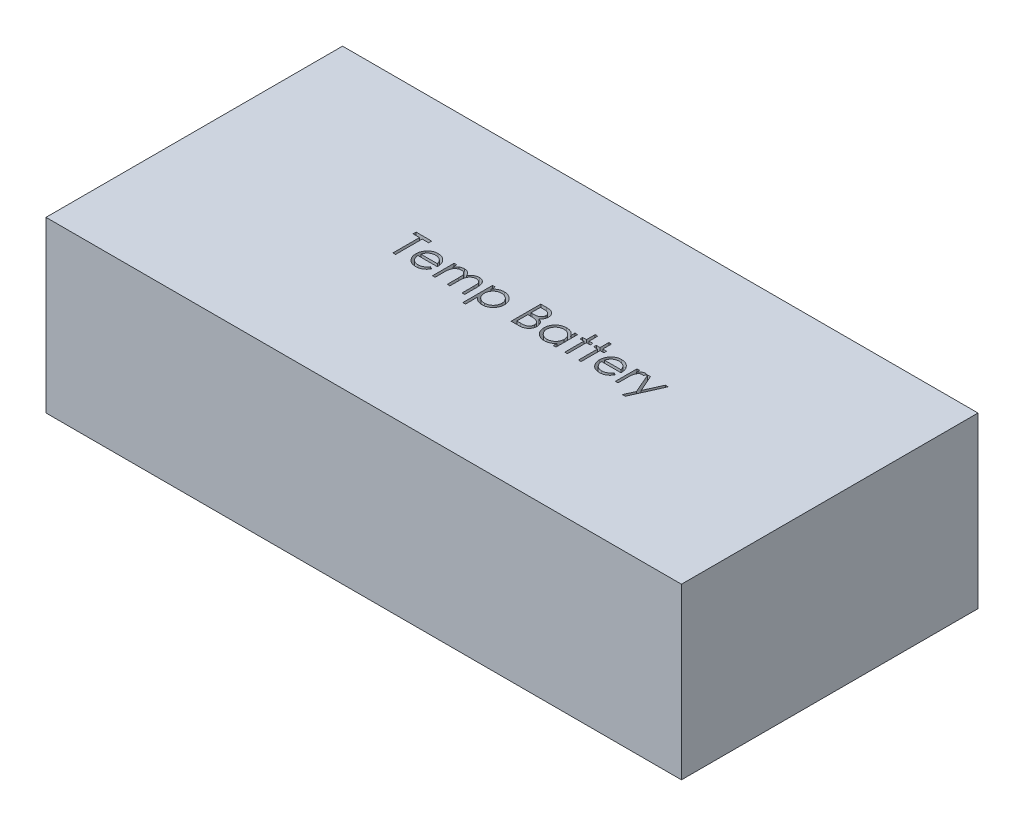
from build123d import *

# Parameters (mm, degrees)
SKETCH1_W           = 75
SKETCH1_H           = 35
BOSS_EXTRUDE1_DEPTH = 20
CUT_EXTRUDE1_DEPTH  = 4


with BuildPart() as part:
    # Sketch1 → Boss-Extrude1 (new body)
    with BuildSketch(Plane(origin=(0, 0, 0), x_dir=(1, 0, 0), z_dir=(0, 1, 0))):
        Rectangle(SKETCH1_W, SKETCH1_H)
    extrude(amount=BOSS_EXTRUDE1_DEPTH)

    # Sketch2 → Cut-Extrude1 (cut)
    # profile 1 of 11: a face of its own
    with BuildSketch(Plane(origin=(0, 20, 0), x_dir=(1, 0, 0), z_dir=(0, 1, 0))):
        Polygon((-14.152078987, 2.473875698), (-14.152078987, 2.832850057), (-12.312335397, 2.832850057), (-12.312335397, 2.473875698), (-13.07515591, 2.473875698), (-13.07515591, -0.667149943), (-13.389258474, -0.667149943), (-13.389258474, 2.473875698), align=None)
    # profile 2 of 11: a face of its own
    with BuildSketch(Plane(origin=(0, 20, 0), x_dir=(1, 0, 0), z_dir=(0, 1, 0))):
        with BuildLine():
            Line((-9.764458794, 0.140542365), (-9.48541232, -0.00599209))
            add(Edge.make_bspline(
                [(-9.48541232, -0.00599209), (-9.507648915, -0.045435421), (-9.550912524, -0.122176524), (-9.625313271, -0.227608385), (-9.703305344, -0.322456101), (-9.788409312, -0.404185755), (-9.878078991, -0.47543714), (-9.972811646, -0.537774965), (-10.073100464, -0.590893485), (-10.178950188, -0.635646013), (-10.291249739, -0.670055507), (-10.410271256, -0.694359728), (-10.536242751, -0.709382996), (-10.622588931, -0.711128137), (-10.666802544, -0.712021738)],
                knots=[0, 0, 0, 0, 1.120438281, 2.179929193, 3.190490725, 4.156257408, 5.095198341, 6.022838206, 6.959905092, 7.901321166, 8.864066838, 9.862729781, 10.905609505, 12, 12, 12, 12], degree=3))
            add(Edge.make_bspline(
                [(-10.666802544, -0.712021738), (-10.715944522, -0.710874562), (-10.811806283, -0.708636756), (-10.951346031, -0.689344291), (-11.082725449, -0.657871932), (-11.205937152, -0.613906391), (-11.320679405, -0.556479067), (-11.42718026, -0.486519585), (-11.525999786, -0.40438733), (-11.614023995, -0.309370887), (-11.693267877, -0.20768893), (-11.763193697, -0.101733045), (-11.821651128, 0.008230179), (-11.869203739, 0.121500703), (-11.907608604, 0.237364597), (-11.934375307, 0.356876065), (-11.949805055, 0.479711649), (-11.952169501, 0.562808985), (-11.953361038, 0.604684993)],
                knots=[0, 0, 0, 0, 1.145258523, 2.234067595, 3.276747158, 4.290159414, 5.277019952, 6.260822364, 7.254936242, 8.264827045, 9.274100331, 10.257902744, 11.220704747, 12.172965371, 13.118907548, 14.062713208, 15.023725156, 16, 16, 16, 16], degree=3))
            add(Edge.make_bspline(
                [(-11.953361038, 0.604684993), (-11.952301896, 0.643979824), (-11.950202818, 0.721856988), (-11.936972031, 0.837122533), (-11.913523738, 0.949150985), (-11.881347414, 1.058035433), (-11.839796168, 1.163593567), (-11.788963948, 1.265889631), (-11.728771571, 1.364814771), (-11.682298897, 1.427217904), (-11.658889884, 1.458651339)],
                knots=[0, 0, 0, 0, 1.024358464, 2.0301432, 3.019427413, 4.004406732, 4.986367066, 5.972626655, 6.978780325, 8, 8, 8, 8], degree=3))
            add(Edge.make_bspline(
                [(-11.658889884, 1.458651339), (-11.627182201, 1.496520209), (-11.564771255, 1.57105836), (-11.459214899, 1.668996686), (-11.344914703, 1.751040461), (-11.223303077, 1.819047597), (-11.092966603, 1.870721244), (-10.955657312, 1.909228826), (-10.809811725, 1.930806837), (-10.710106505, 1.933854671), (-10.659090204, 1.93541416)],
                knots=[0, 0, 0, 0, 1.030682036, 2.02871468, 2.997146059, 3.962720338, 4.930598197, 5.918074684, 6.934738563, 8, 8, 8, 8], degree=3))
            add(Edge.make_bspline(
                [(-10.659090204, 1.93541416), (-10.606642599, 1.934060111), (-10.503752353, 1.931403776), (-10.353720232, 1.906777442), (-10.211759516, 1.867724888), (-10.077927011, 1.812571097), (-9.952209151, 1.741411545), (-9.835423101, 1.653269704), (-9.725571588, 1.550851617), (-9.66166301, 1.472088407), (-9.629142288, 1.432008711)],
                knots=[0, 0, 0, 0, 1.056321875, 2.072262726, 3.055038591, 4.01806755, 4.982017516, 5.957941055, 6.960871419, 8, 8, 8, 8], degree=3))
            add(Edge.make_bspline(
                [(-9.629142288, 1.432008711), (-9.607015349, 1.40180513), (-9.562908756, 1.341599011), (-9.507661656, 1.243427854), (-9.459704261, 1.14071726), (-9.4213713, 1.031806962), (-9.390331799, 0.917987382), (-9.36787498, 0.798444838), (-9.354705362, 0.673214926), (-9.352116664, 0.587888371), (-9.350796935, 0.544388519)],
                knots=[0, 0, 0, 0, 0.94817472, 1.890038105, 2.849395472, 3.817997239, 4.812318967, 5.836947057, 6.897266129, 8, 8, 8, 8], degree=3))
            Line((-9.350796935, 0.544388519), (-11.639258474, 0.544388519))
            add(Edge.make_bspline(
                [(-11.639258474, 0.544388519), (-11.637718867, 0.510688055), (-11.634691293, 0.444417451), (-11.62057615, 0.347446668), (-11.598327376, 0.255073326), (-11.567058314, 0.167990284), (-11.529191468, 0.085060156), (-11.482805752, 0.006898119), (-11.427466198, -0.066139811), (-11.365740498, -0.134706949), (-11.297033403, -0.19576771), (-11.224750656, -0.250419486), (-11.147857091, -0.296225083), (-11.066959007, -0.333404972), (-10.982187222, -0.362511288), (-10.893515027, -0.382379109), (-10.801116911, -0.395686216), (-10.738131177, -0.397165881), (-10.706065365, -0.397919174)],
                knots=[0, 0, 0, 0, 1.094153842, 2.151609401, 3.174256925, 4.172055639, 5.149267565, 6.128595816, 7.11444997, 8.118368179, 9.117203808, 10.09244225, 11.054858984, 12.015122123, 12.976791628, 13.957293641, 14.960065497, 16, 16, 16, 16], degree=3))
            add(Edge.make_bspline(
                [(-10.706065365, -0.397919174), (-10.674714217, -0.397311117), (-10.612507526, -0.396104616), (-10.519866669, -0.384372705), (-10.428727141, -0.365402429), (-10.339466158, -0.339512439), (-10.253895312, -0.307935587), (-10.174649762, -0.269832729), (-10.101769547, -0.227682983), (-10.03365258, -0.179473308), (-9.967581587, -0.120465121), (-9.9020391, -0.0468294), (-9.831762447, 0.040258128), (-9.787772854, 0.105803794), (-9.764458794, 0.140542365)],
                knots=[0, 0, 0, 0, 0.99110716, 1.966546729, 2.947904876, 3.932708344, 4.903319531, 5.828989031, 6.710028674, 7.56322171, 8.463672341, 9.504779593, 10.677557249, 12, 12, 12, 12], degree=3))
        make_face()
        with BuildLine():
            add(Edge.make_bspline(
                [(-9.664899499, 0.858491083), (-9.676396124, 0.900153957), (-9.698523425, 0.980341577), (-9.74475979, 1.091382468), (-9.796831331, 1.190070369), (-9.858453062, 1.275650002), (-9.928271788, 1.351653515), (-10.00891697, 1.4180721), (-10.099352864, 1.477489551), (-10.199112004, 1.52764205), (-10.304753789, 1.570331909), (-10.415359981, 1.598957025), (-10.528217769, 1.618566567), (-10.604552056, 1.620392676), (-10.642964403, 1.621311596)],
                knots=[0, 0, 0, 0, 1.154881502, 2.222775134, 3.210006277, 4.132804581, 5.035138423, 5.962687519, 6.919655026, 7.923214229, 8.944639381, 9.960483929, 10.97369054, 12, 12, 12, 12], degree=3))
            add(Edge.make_bspline(
                [(-10.642964403, 1.621311596), (-10.674313842, 1.620699924), (-10.736285091, 1.619490778), (-10.827586159, 1.608020649), (-10.915265858, 1.589060804), (-10.999971145, 1.563095847), (-11.080592014, 1.528487245), (-11.158786782, 1.487904018), (-11.232567178, 1.438362434), (-11.278708474, 1.40060358), (-11.30201889, 1.381527942)],
                knots=[0, 0, 0, 0, 1.04873581, 2.073130211, 3.073294108, 4.04793562, 5.032784715, 6.005352987, 6.992311501, 8, 8, 8, 8], degree=3))
            add(Edge.make_bspline(
                [(-11.30201889, 1.381527942), (-11.318712172, 1.366433626), (-11.352495307, 1.33588641), (-11.397635828, 1.283257204), (-11.440856301, 1.226505641), (-11.480189953, 1.163460517), (-11.51626754, 1.094839738), (-11.550027517, 1.021222103), (-11.580413929, 0.942048972), (-11.597510039, 0.886876533), (-11.606305749, 0.858491083)],
                knots=[0, 0, 0, 0, 0.879870761, 1.780643979, 2.707998968, 3.669668524, 4.684282772, 5.740141944, 6.837334558, 8, 8, 8, 8], degree=3))
            Line((-11.606305749, 0.858491083), (-9.664899499, 0.858491083))
        make_face(mode=Mode.SUBTRACT)
    # profile 3 of 11: a face of its own
    with BuildSketch(Plane(origin=(0, 20, 0), x_dir=(1, 0, 0), z_dir=(0, 1, 0))):
        with BuildLine():
            Line((-8.722591807, 1.890542365), (-8.408489243, 1.890542365))
            Line((-8.408489243, 1.890542365), (-8.408489243, 1.446031147))
            add(Edge.make_bspline(
                [(-8.408489243, 1.446031147), (-8.380205293, 1.484918749), (-8.326010533, 1.559431122), (-8.237144881, 1.657621406), (-8.148368768, 1.740949561), (-8.084435387, 1.784692432), (-8.053721615, 1.805706628)],
                knots=[0, 0, 0, 0, 1.134379233, 2.173579362, 3.122582517, 4, 4, 4, 4], degree=3))
            add(Edge.make_bspline(
                [(-8.053721615, 1.805706628), (-8.011856953, 1.825711993), (-7.928859053, 1.865373206), (-7.797439828, 1.905606765), (-7.662965158, 1.930331867), (-7.572156944, 1.93371324), (-7.526478025, 1.93541416)],
                knots=[0, 0, 0, 0, 1.014936303, 2.012140481, 3.000054389, 4, 4, 4, 4], degree=3))
            add(Edge.make_bspline(
                [(-7.526478025, 1.93541416), (-7.495585028, 1.934368869), (-7.434449449, 1.932300295), (-7.343865359, 1.91884026), (-7.256006747, 1.895574087), (-7.171392718, 1.863166763), (-7.091672039, 1.823920076), (-7.018582841, 1.777870368), (-6.952958633, 1.726173292), (-6.894832582, 1.666494359), (-6.842563556, 1.597157761), (-6.79448471, 1.516293512), (-6.750059497, 1.422085851), (-6.725438188, 1.35371931), (-6.712475621, 1.317725859)],
                knots=[0, 0, 0, 0, 1.009824226, 1.998387844, 2.986035974, 3.974953746, 4.955485308, 5.885931332, 6.793869504, 7.679848016, 8.601185859, 9.625726857, 10.749998409, 12, 12, 12, 12], degree=3))
            add(Edge.make_bspline(
                [(-6.712475621, 1.317725859), (-6.69876437, 1.342450278), (-6.671782553, 1.391104463), (-6.626476916, 1.459962725), (-6.579009119, 1.524369517), (-6.528974626, 1.584375941), (-6.476550039, 1.639685672), (-6.421488639, 1.690481573), (-6.364103857, 1.736981787), (-6.284311618, 1.791304946), (-6.18049901, 1.849006128), (-6.049610895, 1.899034572), (-5.913460724, 1.9299507), (-5.821043026, 1.933580973), (-5.77437466, 1.93541416)],
                knots=[0, 0, 0, 0, 0.86119277, 1.694706429, 2.50939023, 3.298075842, 4.073795165, 4.829715201, 5.57930267, 6.321991688, 7.768977793, 9.186738141, 10.579381044, 12, 12, 12, 12], degree=3))
            add(Edge.make_bspline(
                [(-5.77437466, 1.93541416), (-5.731493197, 1.933796939), (-5.647570011, 1.930631881), (-5.525392745, 1.905778407), (-5.411450939, 1.86310076), (-5.305973863, 1.804867124), (-5.21081405, 1.73168794), (-5.128097741, 1.644619103), (-5.058327377, 1.54427648), (-5.012748738, 1.449884491), (-4.981833473, 1.366549158), (-4.962772239, 1.295542867), (-4.945932544, 1.217391314), (-4.931951299, 1.132001053), (-4.921732747, 1.039070444), (-4.914162031, 0.938751568), (-4.909037958, 0.830966457), (-4.908675885, 0.756600956), (-4.908489243, 0.718266724)],
                knots=[0, 0, 0, 0, 1.209669288, 2.367440248, 3.500751976, 4.631527125, 5.755587489, 6.87532382, 8.007944318, 9.190864318, 9.82315674, 10.514484317, 11.263564316, 12.079023757, 12.955305781, 13.901327259, 14.918167583, 16, 16, 16, 16], degree=3))
            Line((-4.908489243, 0.718266724), (-4.908489243, -0.667149943))
            Line((-4.908489243, -0.667149943), (-5.222591807, -0.667149943))
            Line((-5.222591807, -0.667149943), (-5.222591807, 0.719668968))
            add(Edge.make_bspline(
                [(-5.222591807, 0.719668968), (-5.22266969, 0.752389541), (-5.222819369, 0.815273508), (-5.225513001, 0.90552596), (-5.230588315, 0.987794317), (-5.236522954, 1.061966405), (-5.244766763, 1.128215193), (-5.255412695, 1.186407612), (-5.266690375, 1.237001423), (-5.285426366, 1.293087471), (-5.315374257, 1.354957681), (-5.360991737, 1.421681257), (-5.418461844, 1.479762057), (-5.484822, 1.530180374), (-5.560370445, 1.571174015), (-5.643635168, 1.600450025), (-5.73409922, 1.618572903), (-5.796722008, 1.620378919), (-5.82906216, 1.621311596)],
                knots=[0, 0, 0, 0, 1.253487763, 2.409012846, 3.458416907, 4.410876679, 5.259312806, 6.014470957, 6.676830364, 7.243083969, 8.276244668, 9.299465089, 10.325150304, 11.392391894, 12.482080715, 13.603491619, 14.762376348, 16, 16, 16, 16], degree=3))
            add(Edge.make_bspline(
                [(-5.82906216, 1.621311596), (-5.868732114, 1.619895438), (-5.947135025, 1.617096573), (-6.061580511, 1.5885227), (-6.171551528, 1.545442449), (-6.273766661, 1.483009992), (-6.367794451, 1.408201628), (-6.448694029, 1.319252033), (-6.515526215, 1.218622106), (-6.560780191, 1.125475403), (-6.589369492, 1.041805959), (-6.608246408, 0.968708587), (-6.622929799, 0.88562702), (-6.636700329, 0.793119529), (-6.645688057, 0.690549348), (-6.653856429, 0.578390947), (-6.657677292, 0.456306988), (-6.65821175, 0.371680299), (-6.658489243, 0.327741884)],
                knots=[0, 0, 0, 0, 1.090531906, 2.155305635, 3.229839962, 4.33261226, 5.44038871, 6.529323825, 7.629011124, 8.757537029, 9.370236727, 10.061839251, 10.834451254, 11.692844982, 12.636905849, 13.66920014, 14.789842145, 16, 16, 16, 16], degree=3))
            Line((-6.658489243, 0.327741884), (-6.658489243, -0.667149943))
            Line((-6.658489243, -0.667149943), (-6.972591807, -0.667149943))
            Line((-6.972591807, -0.667149943), (-6.972591807, 0.633430987))
            add(Edge.make_bspline(
                [(-6.972591807, 0.633430987), (-6.972671238, 0.670124306), (-6.972824055, 0.740718563), (-6.975500373, 0.841952238), (-6.980586994, 0.934033318), (-6.986467543, 1.016854782), (-6.994927721, 1.090266111), (-7.004537483, 1.154660869), (-7.015886094, 1.20987762), (-7.034675978, 1.270441005), (-7.063390447, 1.337161928), (-7.109578709, 1.408302949), (-7.167186289, 1.470571046), (-7.234757165, 1.523729795), (-7.310762847, 1.567671276), (-7.394746248, 1.599331028), (-7.485951161, 1.617755317), (-7.548828867, 1.620103814), (-7.581165525, 1.621311596)],
                knots=[0, 0, 0, 0, 1.320475261, 2.540461679, 3.643808994, 4.639130445, 5.527981419, 6.302341397, 6.981980563, 7.553956391, 8.582137848, 9.585246428, 10.591171744, 11.620968678, 12.668337649, 13.738356861, 14.836885341, 16, 16, 16, 16], degree=3))
            add(Edge.make_bspline(
                [(-7.581165525, 1.621311596), (-7.619181736, 1.619781136), (-7.694946696, 1.616730983), (-7.806248665, 1.589276709), (-7.913734349, 1.546272635), (-8.015689048, 1.486612816), (-8.109363196, 1.412713737), (-8.191371463, 1.325798841), (-8.260313989, 1.226949808), (-8.306045804, 1.134785291), (-8.335544278, 1.053212016), (-8.355139613, 0.983861069), (-8.371979239, 0.90686082), (-8.38449326, 0.821973709), (-8.396573676, 0.729752615), (-8.402403985, 0.629738125), (-8.408075547, 0.522016038), (-8.408347962, 0.447643492), (-8.408489243, 0.409072012)],
                knots=[0, 0, 0, 0, 1.098833095, 2.189935336, 3.297829714, 4.440610912, 5.596351641, 6.740013378, 7.886572111, 9.072425424, 9.705826452, 10.395263256, 11.156850408, 11.985370555, 12.878090359, 13.847760091, 14.883794034, 16, 16, 16, 16], degree=3))
            Line((-8.408489243, 0.409072012), (-8.408489243, -0.667149943))
            Line((-8.408489243, -0.667149943), (-8.722591807, -0.667149943))
            Line((-8.722591807, -0.667149943), (-8.722591807, 1.890542365))
        make_face()
    # profile 4 of 11: a face of its own
    with BuildSketch(Plane(origin=(0, 20, 0), x_dir=(1, 0, 0), z_dir=(0, 1, 0))):
        with BuildLine():
            Line((-4.190540525, 1.890542365), (-3.876437961, 1.890542365))
            Line((-3.876437961, 1.890542365), (-3.876437961, 1.417285153))
            add(Edge.make_bspline(
                [(-3.876437961, 1.417285153), (-3.843080477, 1.460222887), (-3.778256882, 1.54366378), (-3.666531977, 1.651653909), (-3.548605168, 1.742729212), (-3.421441756, 1.814111745), (-3.287018066, 1.867932557), (-3.145885748, 1.907712007), (-2.996846983, 1.931153482), (-2.894950531, 1.933975143), (-2.842984435, 1.93541416)],
                knots=[0, 0, 0, 0, 1.0828784, 2.104357462, 3.088488658, 4.04616522, 5.001424249, 5.969181776, 6.964304535, 8, 8, 8, 8], degree=3))
            add(Edge.make_bspline(
                [(-2.842984435, 1.93541416), (-2.797592832, 1.934100981), (-2.707873944, 1.931505414), (-2.575810715, 1.913932359), (-2.448635331, 1.883814667), (-2.327067277, 1.840413752), (-2.209804212, 1.786758282), (-2.098582112, 1.719041246), (-1.991668557, 1.640635055), (-1.891752368, 1.550402904), (-1.799431, 1.452774638), (-1.719584819, 1.347752334), (-1.650712915, 1.238789747), (-1.595042618, 1.124197655), (-1.551434271, 1.004878425), (-1.520419593, 0.880349984), (-1.50196195, 0.751074044), (-1.499485498, 0.663171323), (-1.498232833, 0.618707429)],
                knots=[0, 0, 0, 0, 1.041296284, 2.058176809, 3.050446431, 4.034000596, 5.01514041, 6.003636468, 7.015969324, 8.052561599, 9.08815499, 10.094063707, 11.074456064, 12.040834395, 13.011057502, 13.983766392, 14.980127149, 16, 16, 16, 16], degree=3))
            add(Edge.make_bspline(
                [(-1.498232833, 0.618707429), (-1.499458318, 0.573305121), (-1.501875153, 0.483765216), (-1.520620159, 0.352278119), (-1.550577033, 0.225790745), (-1.593635216, 0.104513481), (-1.649276704, -0.01147017), (-1.716981265, -0.122076566), (-1.796867732, -0.227270269), (-1.888168859, -0.325623169), (-1.987221795, -0.416222482), (-2.093099285, -0.495460552), (-2.20415821, -0.562001927), (-2.319830378, -0.617584887), (-2.441106016, -0.659477071), (-2.567419294, -0.689694871), (-2.69870144, -0.708329367), (-2.788002592, -0.710781509), (-2.83316873, -0.712021738)],
                knots=[0, 0, 0, 0, 1.038740735, 2.04854663, 3.033179607, 4.009277356, 4.987731542, 5.972001279, 6.972200261, 8.005528982, 9.039189865, 10.040446548, 11.026516639, 11.997840187, 12.972163198, 13.956796175, 14.96660207, 16, 16, 16, 16], degree=3))
            add(Edge.make_bspline(
                [(-2.83316873, -0.712021738), (-2.883996302, -0.71072693), (-2.984395658, -0.708169305), (-3.131193329, -0.682249895), (-3.27247018, -0.643512959), (-3.406661005, -0.586813966), (-3.534828818, -0.51455845), (-3.656248623, -0.426448244), (-3.771565376, -0.322667619), (-3.840974134, -0.243935803), (-3.876437961, -0.203708436)],
                knots=[0, 0, 0, 0, 1.014726462, 2.004382257, 2.969841629, 3.936926163, 4.907207904, 5.903978561, 6.929055279, 8, 8, 8, 8], degree=3))
            Line((-3.876437961, -0.203708436), (-3.876437961, -1.609457635))
            Line((-3.876437961, -1.609457635), (-4.190540525, -1.609457635))
            Line((-4.190540525, -1.609457635), (-4.190540525, 1.890542365))
        make_face()
        with BuildLine():
            add(Edge.make_bspline(
                [(-2.845788922, 1.621311596), (-2.881368485, 1.620671338), (-2.951415473, 1.619410834), (-3.054087692, 1.604436885), (-3.152983119, 1.582699144), (-3.247105071, 1.549787244), (-3.337355687, 1.509388431), (-3.423039852, 1.45890642), (-3.50409742, 1.399254414), (-3.58032445, 1.33157507), (-3.649187743, 1.257000382), (-3.710150671, 1.177412573), (-3.761357977, 1.092912433), (-3.803859997, 1.00428707), (-3.836203279, 0.910841785), (-3.859158999, 0.813108773), (-3.873589352, 0.71098106), (-3.875478289, 0.641425054), (-3.876437961, 0.606087237)],
                knots=[0, 0, 0, 0, 1.05670511, 2.080379991, 3.077984906, 4.06214886, 5.038337365, 6.01289324, 7.01187578, 8.025460281, 9.038092164, 10.024533457, 11.000252242, 11.969694649, 12.940728589, 13.933144304, 14.949937299, 16, 16, 16, 16], degree=3))
            add(Edge.make_bspline(
                [(-3.876437961, 0.606087237), (-3.874847105, 0.559699124), (-3.871730483, 0.468820883), (-3.846393115, 0.336036761), (-3.805157851, 0.210385106), (-3.746629137, 0.092924069), (-3.672681563, -0.015058767), (-3.583583407, -0.111749373), (-3.480140856, -0.196539964), (-3.364073664, -0.267961218), (-3.239651533, -0.325949284), (-3.109865621, -0.367463495), (-2.97650074, -0.393035723), (-2.886332421, -0.396282542), (-2.84088107, -0.397919174)],
                knots=[0, 0, 0, 0, 1.03728447, 2.032128127, 3.01272805, 3.987917167, 4.958271349, 5.931593992, 6.91984656, 7.941419022, 8.973179163, 9.983609215, 10.983593296, 12, 12, 12, 12], degree=3))
            add(Edge.make_bspline(
                [(-2.84088107, -0.397919174), (-2.796345302, -0.396362797), (-2.707949809, -0.393273668), (-2.577791687, -0.366535481), (-2.451301049, -0.325690456), (-2.331120877, -0.2661309), (-2.218297389, -0.193140842), (-2.116415835, -0.105580809), (-2.027408922, -0.004090865), (-1.951544567, 0.108917638), (-1.890413081, 0.230093021), (-1.844482841, 0.35547441), (-1.817974268, 0.484619833), (-1.81421748, 0.571617546), (-1.812335397, 0.61520182)],
                knots=[0, 0, 0, 0, 1.00104056, 1.986885549, 2.97790532, 3.984399681, 4.995088187, 5.994304198, 6.996462723, 8.023150851, 9.048424203, 10.043036403, 11.019596776, 12, 12, 12, 12], degree=3))
            add(Edge.make_bspline(
                [(-1.812335397, 0.61520182), (-1.813790131, 0.659056809), (-1.816688264, 0.746425113), (-1.845235302, 0.875188016), (-1.88813528, 1.001075992), (-1.950694332, 1.120596542), (-2.024895601, 1.233370624), (-2.114642598, 1.332924503), (-2.215258795, 1.420095176), (-2.327947959, 1.492110586), (-2.448888384, 1.549396081), (-2.5762033, 1.59127972), (-2.709246902, 1.616453469), (-2.799874557, 1.619677976), (-2.845788922, 1.621311596)],
                knots=[0, 0, 0, 0, 0.983928682, 1.960191568, 2.949917689, 3.96440592, 4.982380491, 5.975291189, 6.965713506, 7.964880129, 8.970154049, 9.96478489, 10.968906225, 12, 12, 12, 12], degree=3))
        make_face(mode=Mode.SUBTRACT)
    # profile 5 of 11: a face of its own
    with BuildSketch(Plane(origin=(0, 20, 0), x_dir=(1, 0, 0), z_dir=(0, 1, 0))):
        with BuildLine():
            Line((0.565869731, 2.832850057), (1.24876236, 2.832850057))
            add(Edge.make_bspline(
                [(1.24876236, 2.832850057), (1.282190838, 2.832674307), (1.346983548, 2.832333659), (1.44120299, 2.827050528), (1.529451801, 2.819846858), (1.611755573, 2.808416765), (1.688076275, 2.794624988), (1.758643913, 2.777923172), (1.823234085, 2.757896558), (1.900346821, 2.726050277), (1.988267482, 2.678727109), (2.083465875, 2.608798544), (2.164870114, 2.52326608), (2.235056431, 2.426783425), (2.290857551, 2.320647653), (2.331226848, 2.207388464), (2.356784724, 2.088466723), (2.359413158, 2.006823545), (2.360741526, 1.965562397)],
                knots=[0, 0, 0, 0, 1.001505555, 1.941167018, 2.826882275, 3.653841531, 4.429895133, 5.150066043, 5.825578002, 6.45369114, 7.647487171, 8.808567382, 9.977351308, 11.170798116, 12.373658725, 13.556498008, 14.765093433, 16, 16, 16, 16], degree=3))
            add(Edge.make_bspline(
                [(2.360741526, 1.965562397), (2.359648308, 1.926909841), (2.357500031, 1.850953924), (2.336957271, 1.739859815), (2.304796603, 1.634108596), (2.260091354, 1.534086211), (2.201989357, 1.442052598), (2.133131039, 1.357265332), (2.050054236, 1.283314275), (1.987810996, 1.241971372), (1.956194251, 1.220971051)],
                knots=[0, 0, 0, 0, 1.044552857, 2.05264487, 3.044412934, 4.028983338, 5.005914585, 5.980388656, 6.974128949, 8, 8, 8, 8], degree=3))
            add(Edge.make_bspline(
                [(1.956194251, 1.220971051), (1.995954678, 1.205706052), (2.072026226, 1.176500328), (2.176712238, 1.124864864), (2.266907083, 1.068702753), (2.343304229, 1.007370903), (2.408641884, 0.941262092), (2.465694826, 0.869406978), (2.5143762, 0.79086822), (2.556089123, 0.706464685), (2.588637879, 0.617058216), (2.613013784, 0.52348744), (2.626981233, 0.426087885), (2.628968874, 0.359802506), (2.629972296, 0.326339641)],
                knots=[0, 0, 0, 0, 1.27268992, 2.434971085, 3.483601985, 4.442670788, 5.356604649, 6.2567628, 7.179492994, 8.113709626, 9.066344395, 10.018646069, 10.999752585, 12, 12, 12, 12], degree=3))
            add(Edge.make_bspline(
                [(2.629972296, 0.326339641), (2.62899545, 0.292172768), (2.627073478, 0.22494849), (2.612893506, 0.126193356), (2.588884399, 0.031818409), (2.555813252, -0.058786773), (2.512650938, -0.145446908), (2.460122974, -0.228260172), (2.39749141, -0.306394503), (2.327428541, -0.380718126), (2.248166395, -0.447545913), (2.162650641, -0.50706162), (2.069804321, -0.556007682), (1.971152327, -0.597123703), (1.865588011, -0.628530902), (1.753585403, -0.650503476), (1.635241101, -0.665308513), (1.55403135, -0.666525718), (1.512384155, -0.667149943)],
                knots=[0, 0, 0, 0, 0.978564426, 1.925352924, 2.850884081, 3.763762016, 4.682927383, 5.618979971, 6.567305752, 7.547517671, 8.540179244, 9.531824382, 10.526200242, 11.540722885, 12.589160233, 13.674978461, 14.80764778, 16, 16, 16, 16], degree=3))
            Line((1.512384155, -0.667149943), (0.565869731, -0.667149943))
            Line((0.565869731, -0.667149943), (0.565869731, 2.832850057))
        make_face()
        with BuildLine():
            Line((0.879972296, 2.473875698), (0.879972296, 1.352080826))
            Line((0.879972296, 1.352080826), (1.091009956, 1.352080826))
            add(Edge.make_bspline(
                [(1.091009956, 1.352080826), (1.121858751, 1.35248075), (1.18146491, 1.353253482), (1.267784807, 1.355466999), (1.347909825, 1.361665043), (1.421701658, 1.367861305), (1.489044102, 1.377935892), (1.549787964, 1.389928015), (1.604886561, 1.40261092), (1.668426106, 1.424180407), (1.740499055, 1.456058083), (1.817332159, 1.505529919), (1.885066628, 1.564454272), (1.942263816, 1.632445234), (1.989075287, 1.707311419), (2.021589002, 1.7878583), (2.043636286, 1.872078432), (2.045627817, 1.929896685), (2.046638962, 1.959252301)],
                knots=[0, 0, 0, 0, 1.156816544, 2.235205308, 3.236616184, 4.169592532, 5.011045266, 5.787822928, 6.49130361, 7.128639758, 8.301311294, 9.436451833, 10.541879658, 11.654887649, 12.756523258, 13.837046038, 14.901820046, 16, 16, 16, 16], degree=3))
            add(Edge.make_bspline(
                [(2.046638962, 1.959252301), (2.046112782, 1.978678072), (2.045080622, 2.016783844), (2.03662732, 2.072333199), (2.022259745, 2.124576951), (2.003805452, 2.174231061), (1.978016763, 2.219742912), (1.9476533, 2.262686107), (1.91096761, 2.301598226), (1.869210297, 2.337967724), (1.821201674, 2.370212252), (1.766970382, 2.398453015), (1.705782705, 2.421193792), (1.63866985, 2.441109944), (1.564598763, 2.455098238), (1.484424209, 2.466751626), (1.39748949, 2.472684368), (1.337344388, 2.473469731), (1.306254347, 2.473875698)],
                knots=[0, 0, 0, 0, 0.91205012, 1.789085906, 2.630437955, 3.453916878, 4.269457761, 5.079663411, 5.91843418, 6.774407191, 7.675494373, 8.627863946, 9.638891023, 10.736472738, 11.911756761, 13.175263542, 14.539845004, 16, 16, 16, 16], degree=3))
            Line((1.306254347, 2.473875698), (0.879972296, 2.473875698))
        make_face(mode=Mode.SUBTRACT)
        with BuildLine():
            Line((0.879972296, 0.993106468), (0.879972296, -0.308175584))
            Line((0.879972296, -0.308175584), (1.327288001, -0.308175584))
            add(Edge.make_bspline(
                [(1.327288001, -0.308175584), (1.359306927, -0.307791836), (1.421019185, -0.307052214), (1.510120415, -0.304637659), (1.592703519, -0.299145384), (1.668391655, -0.290499534), (1.738002107, -0.281121085), (1.80069981, -0.268509804), (1.856993004, -0.254060843), (1.922267312, -0.231726671), (1.99577082, -0.1970302), (2.074981676, -0.144715974), (2.145407894, -0.082392666), (2.205213154, -0.010261752), (2.254226142, 0.068169575), (2.289881597, 0.151314925), (2.311872454, 0.237800453), (2.314534623, 0.296767165), (2.315869731, 0.326339641)],
                knots=[0, 0, 0, 0, 1.160039823, 2.235823828, 3.228722157, 4.157150951, 4.99529583, 5.772374946, 6.472645482, 7.099169577, 8.269452708, 9.405989375, 10.527446681, 11.663510218, 12.788923519, 13.866172445, 14.929861265, 16, 16, 16, 16], degree=3))
            add(Edge.make_bspline(
                [(2.315869731, 0.326339641), (2.315593627, 0.344832981), (2.315045872, 0.381521363), (2.306785257, 0.435437182), (2.294771387, 0.487663055), (2.279239953, 0.538340796), (2.256620486, 0.586554172), (2.230213941, 0.633256732), (2.19925254, 0.678510211), (2.151008374, 0.735722465), (2.080836389, 0.801639478), (1.981129614, 0.86617698), (1.867757316, 0.918224787), (1.785529823, 0.940324263), (1.743053225, 0.951740282)],
                knots=[0, 0, 0, 0, 0.723448775, 1.435228256, 2.130040452, 2.821711965, 3.505591119, 4.210454504, 4.921174351, 5.648778258, 7.137944449, 8.670945889, 10.280296675, 12, 12, 12, 12], degree=3))
            add(Edge.make_bspline(
                [(1.743053225, 0.951740282), (1.726024129, 0.955195366), (1.689101537, 0.9626867), (1.628893956, 0.970594404), (1.560158088, 0.977639464), (1.48273521, 0.982850621), (1.396527369, 0.988237165), (1.30135045, 0.990331986), (1.197593136, 0.992831246), (1.125600763, 0.99301238), (1.088205469, 0.993106468)],
                knots=[0, 0, 0, 0, 0.634451884, 1.375622551, 2.216452059, 3.157844607, 4.20941857, 5.370758133, 6.634282058, 8, 8, 8, 8], degree=3))
            Line((1.088205469, 0.993106468), (0.879972296, 0.993106468))
        make_face(mode=Mode.SUBTRACT)
    # profile 6 of 11: a face of its own
    with BuildSketch(Plane(origin=(0, 20, 0), x_dir=(1, 0, 0), z_dir=(0, 1, 0))):
        with BuildLine():
            Line((5.860741526, 1.890542365), (5.860741526, -0.667149943))
            Line((5.860741526, -0.667149943), (5.546638962, -0.667149943))
            Line((5.546638962, -0.667149943), (5.546638962, -0.22474209))
            add(Edge.make_bspline(
                [(5.546638962, -0.22474209), (5.511220172, -0.264781684), (5.442099956, -0.342919455), (5.326658838, -0.445001628), (5.20429066, -0.529379949), (5.075589339, -0.597529865), (4.940671096, -0.648721921), (4.799835009, -0.68510808), (4.653023628, -0.708501916), (4.552771273, -0.710837937), (4.501967488, -0.712021738)],
                knots=[0, 0, 0, 0, 1.074387032, 2.096679803, 3.090159297, 4.057316773, 5.018401886, 5.985159533, 6.978961417, 8, 8, 8, 8], degree=3))
            add(Edge.make_bspline(
                [(4.501967488, -0.712021738), (4.456799534, -0.710795365), (4.367726329, -0.708376905), (4.236697252, -0.689614601), (4.110605003, -0.65948398), (3.98933043, -0.61758309), (3.873658284, -0.562002269), (3.762598188, -0.49546102), (3.656725496, -0.41622019), (3.557653957, -0.325632162), (3.466421956, -0.227237175), (3.386360684, -0.122291628), (3.319607604, -0.011249324), (3.263787523, 0.10448383), (3.220791179, 0.225798749), (3.190817545, 0.352275917), (3.172077098, 0.483765791), (3.169659637, 0.573305314), (3.168433834, 0.618707429)],
                knots=[0, 0, 0, 0, 1.033919861, 2.038935746, 3.024066025, 3.998881131, 4.97069526, 5.957263378, 6.95902576, 7.993208707, 9.027059324, 10.027763471, 11.009749337, 11.988697705, 12.965288445, 13.950418724, 14.960734635, 16, 16, 16, 16], degree=3))
            add(Edge.make_bspline(
                [(3.168433834, 0.618707429), (3.169686805, 0.663171133), (3.172163862, 0.751073476), (3.190617082, 0.880352174), (3.221648091, 1.004870435), (3.265195938, 1.124227378), (3.321037893, 1.238567428), (3.38896598, 1.347971453), (3.468985105, 1.452740851), (3.561237512, 1.550412077), (3.661172282, 1.640632692), (3.768081013, 1.719041737), (3.879304294, 1.786758586), (3.996567305, 1.840412062), (4.11813441, 1.883821167), (4.245087856, 1.913854135), (4.376899434, 1.931551456), (4.466389926, 1.93411422), (4.511783193, 1.93541416)],
                knots=[0, 0, 0, 0, 1.020392517, 2.01726096, 2.990465484, 3.961182959, 4.928053699, 5.906110375, 6.912531644, 7.948652711, 8.985773172, 9.998621852, 10.987621588, 11.969261332, 12.953316658, 13.946091881, 14.958173133, 16, 16, 16, 16], degree=3))
            add(Edge.make_bspline(
                [(4.511783193, 1.93541416), (4.563983052, 1.933976408), (4.666344512, 1.931157045), (4.816072521, 1.907694318), (4.957716999, 1.868055851), (5.092371351, 1.814138353), (5.219552037, 1.742489624), (5.338055022, 1.652109663), (5.449120505, 1.543568476), (5.513500797, 1.460198031), (5.546638962, 1.417285153)],
                knots=[0, 0, 0, 0, 1.038897134, 2.037228247, 3.008116434, 3.962042015, 4.918381754, 5.904844433, 6.921570401, 8, 8, 8, 8], degree=3))
            Line((5.546638962, 1.417285153), (5.546638962, 1.890542365))
            Line((5.546638962, 1.890542365), (5.860741526, 1.890542365))
        make_face()
        with BuildLine():
            add(Edge.make_bspline(
                [(4.515989924, 1.621311596), (4.470075586, 1.619677958), (4.379447986, 1.616453417), (4.246403984, 1.591279922), (4.11909057, 1.549395327), (3.998144495, 1.492113426), (3.885476279, 1.42008469), (3.784782608, 1.332963306), (3.695239907, 1.233126292), (3.619931642, 1.121024182), (3.558541146, 1.000846091), (3.515374114, 0.875221653), (3.486904866, 0.746416675), (3.483996346, 0.659053989), (3.482536398, 0.61520182)],
                knots=[0, 0, 0, 0, 1.031046209, 2.035121221, 3.029706178, 4.034933723, 5.034054252, 6.02443088, 7.017295772, 8.038157696, 9.050218397, 10.03989886, 11.016116709, 12, 12, 12, 12], degree=3))
            add(Edge.make_bspline(
                [(3.482536398, 0.61520182), (3.484401291, 0.571611713), (3.488123768, 0.484602357), (3.514874463, 0.35562178), (3.559754336, 0.229967738), (3.620996399, 0.108706745), (3.697683024, -0.003877356), (3.786571676, -0.105617478), (3.888521957, -0.193107067), (4.001449465, -0.26634464), (4.122057435, -0.325507161), (4.248891366, -0.366672801), (4.379567005, -0.393250581), (4.468419338, -0.396355058), (4.513185437, -0.397919174)],
                knots=[0, 0, 0, 0, 0.979072187, 1.954306742, 2.945804271, 3.96968567, 4.997920485, 5.998718438, 6.996577872, 8.005894225, 9.015743152, 10.005417472, 10.995077863, 12, 12, 12, 12], degree=3))
            add(Edge.make_bspline(
                [(4.513185437, -0.397919174), (4.558631939, -0.39625921), (4.649020526, -0.392957706), (4.782459234, -0.367676441), (4.911954197, -0.325907642), (5.035741425, -0.268008516), (5.151057556, -0.19625116), (5.254555434, -0.112244069), (5.342071402, -0.014540885), (5.416264012, 0.092835569), (5.474439428, 0.210547565), (5.516815488, 0.335881756), (5.541869393, 0.468842504), (5.545027123, 0.559706431), (5.546638962, 0.606087237)],
                knots=[0, 0, 0, 0, 1.01762866, 2.023962475, 3.030623092, 4.058876274, 5.077231937, 6.066672613, 7.034107872, 8.005628644, 8.981990164, 9.965428785, 10.961468474, 12, 12, 12, 12], degree=3))
            add(Edge.make_bspline(
                [(5.546638962, 0.606087237), (5.545679306, 0.641425067), (5.543790398, 0.710981101), (5.529359829, 0.813108618), (5.506404902, 0.910842344), (5.474058732, 1.004285033), (5.431567448, 1.092920049), (5.380319682, 1.177383809), (5.319414232, 1.25723702), (5.249831536, 1.331380091), (5.173666334, 1.399006554), (5.093071793, 1.459370794), (5.007093046, 1.508959567), (4.917176009, 1.550000838), (4.823164675, 1.582659988), (4.724294055, 1.604447682), (4.621615068, 1.619408003), (4.551569013, 1.620670384), (4.515989924, 1.621311596)],
                knots=[0, 0, 0, 0, 1.050140795, 2.067009409, 3.05949893, 4.030605086, 5.00011959, 5.97591094, 6.962425594, 7.979863591, 8.993523472, 9.986985069, 10.967611495, 11.937549037, 12.921786183, 13.919465291, 14.943216303, 16, 16, 16, 16], degree=3))
        make_face(mode=Mode.SUBTRACT)
    # profile 7 of 11: a face of its own
    with BuildSketch(Plane(origin=(0, 20, 0), x_dir=(1, 0, 0), z_dir=(0, 1, 0))):
        Polygon((6.892792808, 2.922593647), (7.206895372, 2.922593647), (7.206895372, 1.890542365), (7.655613321, 1.890542365), (7.655613321, 1.576439801), (7.206895372, 1.576439801), (7.206895372, -0.667149943), (6.892792808, -0.667149943), (6.892792808, 1.576439801), (6.44407486, 1.576439801), (6.44407486, 1.890542365), (6.892792808, 1.890542365), align=None)
    # profile 8 of 11: a face of its own
    with BuildSketch(Plane(origin=(0, 20, 0), x_dir=(1, 0, 0), z_dir=(0, 1, 0))):
        Polygon((8.508177424, 2.922593647), (8.822279988, 2.922593647), (8.822279988, 1.890542365), (9.270997937, 1.890542365), (9.270997937, 1.576439801), (8.822279988, 1.576439801), (8.822279988, -0.667149943), (8.508177424, -0.667149943), (8.508177424, 1.576439801), (8.059459475, 1.576439801), (8.059459475, 1.890542365), (8.508177424, 1.890542365), align=None)
    # profile 9 of 11: a face of its own
    with BuildSketch(Plane(origin=(0, 20, 0), x_dir=(1, 0, 0), z_dir=(0, 1, 0))):
        with BuildLine():
            Line((11.908618129, 0.140542365), (12.187664603, -0.00599209))
            add(Edge.make_bspline(
                [(12.187664603, -0.00599209), (12.165428008, -0.045435421), (12.1221644, -0.122176524), (12.047763652, -0.227608385), (11.969771579, -0.322456101), (11.884667611, -0.404185755), (11.794997932, -0.47543714), (11.700265277, -0.537774965), (11.59997646, -0.590893485), (11.494126735, -0.635646013), (11.381827184, -0.670055507), (11.262805667, -0.694359728), (11.136834172, -0.709382996), (11.050487992, -0.711128137), (11.006274379, -0.712021738)],
                knots=[0, 0, 0, 0, 1.120438281, 2.179929193, 3.190490725, 4.156257408, 5.095198341, 6.022838206, 6.959905092, 7.901321166, 8.864066838, 9.862729781, 10.905609505, 12, 12, 12, 12], degree=3))
            add(Edge.make_bspline(
                [(11.006274379, -0.712021738), (10.957132401, -0.710874562), (10.86127064, -0.708636756), (10.721730893, -0.689344291), (10.590351474, -0.657871932), (10.467139771, -0.613906391), (10.352397518, -0.556479067), (10.245896663, -0.486519585), (10.147077138, -0.40438733), (10.059052928, -0.309370887), (9.979809046, -0.20768893), (9.909883226, -0.101733045), (9.851425795, 0.008230179), (9.803873184, 0.121500703), (9.765468319, 0.237364597), (9.738701616, 0.356876065), (9.723271868, 0.479711649), (9.720907422, 0.562808985), (9.719715885, 0.604684993)],
                knots=[0, 0, 0, 0, 1.145258523, 2.234067595, 3.276747158, 4.290159414, 5.277019952, 6.260822364, 7.254936242, 8.264827045, 9.274100331, 10.257902744, 11.220704747, 12.172965371, 13.118907548, 14.062713208, 15.023725156, 16, 16, 16, 16], degree=3))
            add(Edge.make_bspline(
                [(9.719715885, 0.604684993), (9.720775027, 0.643979824), (9.722874105, 0.721856988), (9.736104892, 0.837122533), (9.759553185, 0.949150985), (9.791729509, 1.058035433), (9.833280755, 1.163593567), (9.884112975, 1.265889631), (9.944305352, 1.364814771), (9.990778026, 1.427217904), (10.014187039, 1.458651339)],
                knots=[0, 0, 0, 0, 1.024358464, 2.0301432, 3.019427413, 4.004406732, 4.986367066, 5.972626655, 6.978780325, 8, 8, 8, 8], degree=3))
            add(Edge.make_bspline(
                [(10.014187039, 1.458651339), (10.045894722, 1.496520209), (10.108305669, 1.57105836), (10.213862024, 1.668996686), (10.32816222, 1.751040461), (10.449773846, 1.819047597), (10.58011032, 1.870721244), (10.717419611, 1.909228826), (10.863265198, 1.930806837), (10.962970418, 1.933854671), (11.013986719, 1.93541416)],
                knots=[0, 0, 0, 0, 1.030682036, 2.02871468, 2.997146059, 3.962720338, 4.930598197, 5.918074684, 6.934738563, 8, 8, 8, 8], degree=3))
            add(Edge.make_bspline(
                [(11.013986719, 1.93541416), (11.066434324, 1.934060111), (11.16932457, 1.931403776), (11.319356691, 1.906777442), (11.461317407, 1.867724888), (11.595149912, 1.812571097), (11.720867773, 1.741411545), (11.837653822, 1.653269704), (11.947505335, 1.550851617), (12.011413913, 1.472088407), (12.043934635, 1.432008711)],
                knots=[0, 0, 0, 0, 1.056321875, 2.072262726, 3.055038591, 4.01806755, 4.982017516, 5.957941055, 6.960871419, 8, 8, 8, 8], degree=3))
            add(Edge.make_bspline(
                [(12.043934635, 1.432008711), (12.066061574, 1.40180513), (12.110168167, 1.341599011), (12.165415267, 1.243427854), (12.213372662, 1.14071726), (12.251705623, 1.031806962), (12.282745124, 0.917987382), (12.305201943, 0.798444838), (12.318371561, 0.673214926), (12.320960259, 0.587888371), (12.322279988, 0.544388519)],
                knots=[0, 0, 0, 0, 0.94817472, 1.890038105, 2.849395472, 3.817997239, 4.812318967, 5.836947057, 6.897266129, 8, 8, 8, 8], degree=3))
            Line((12.322279988, 0.544388519), (10.033818449, 0.544388519))
            add(Edge.make_bspline(
                [(10.033818449, 0.544388519), (10.035358056, 0.510688055), (10.03838563, 0.444417451), (10.052500773, 0.347446668), (10.074749547, 0.255073326), (10.106018609, 0.167990284), (10.143885455, 0.085060156), (10.190271171, 0.006898119), (10.245610725, -0.066139811), (10.307336425, -0.134706949), (10.37604352, -0.19576771), (10.448326267, -0.250419486), (10.525219832, -0.296225083), (10.606117916, -0.333404972), (10.690889701, -0.362511288), (10.779561896, -0.382379109), (10.871960012, -0.395686216), (10.934945746, -0.397165881), (10.967011558, -0.397919174)],
                knots=[0, 0, 0, 0, 1.094153842, 2.151609401, 3.174256925, 4.172055639, 5.149267565, 6.128595816, 7.11444997, 8.118368179, 9.117203808, 10.09244225, 11.054858984, 12.015122123, 12.976791628, 13.957293641, 14.960065497, 16, 16, 16, 16], degree=3))
            add(Edge.make_bspline(
                [(10.967011558, -0.397919174), (10.998362706, -0.397311117), (11.060569397, -0.396104616), (11.153210254, -0.384372705), (11.244349782, -0.365402429), (11.333610765, -0.339512439), (11.419181611, -0.307935587), (11.498427161, -0.269832729), (11.571307377, -0.227682983), (11.639424343, -0.179473308), (11.705495336, -0.120465121), (11.771037823, -0.0468294), (11.841314476, 0.040258128), (11.885304069, 0.105803794), (11.908618129, 0.140542365)],
                knots=[0, 0, 0, 0, 0.99110716, 1.966546729, 2.947904876, 3.932708344, 4.903319531, 5.828989031, 6.710028674, 7.56322171, 8.463672341, 9.504779593, 10.677557249, 12, 12, 12, 12], degree=3))
        make_face()
        with BuildLine():
            add(Edge.make_bspline(
                [(12.008177424, 0.858491083), (11.996680799, 0.900153957), (11.974553498, 0.980341577), (11.928317133, 1.091382468), (11.876245593, 1.190070369), (11.814623861, 1.275650002), (11.744805136, 1.351653515), (11.664159953, 1.4180721), (11.573724059, 1.477489551), (11.473964919, 1.52764205), (11.368323134, 1.570331909), (11.257716942, 1.598957025), (11.144859154, 1.618566567), (11.068524867, 1.620392676), (11.03011252, 1.621311596)],
                knots=[0, 0, 0, 0, 1.154881502, 2.222775134, 3.210006277, 4.132804581, 5.035138423, 5.962687519, 6.919655026, 7.923214229, 8.944639381, 9.960483929, 10.97369054, 12, 12, 12, 12], degree=3))
            add(Edge.make_bspline(
                [(11.03011252, 1.621311596), (10.998763081, 1.620699924), (10.936791832, 1.619490778), (10.845490764, 1.608020649), (10.757811065, 1.589060804), (10.673105778, 1.563095847), (10.592484909, 1.528487245), (10.514290141, 1.487904018), (10.440509745, 1.438362434), (10.394368449, 1.40060358), (10.371058033, 1.381527942)],
                knots=[0, 0, 0, 0, 1.04873581, 2.073130211, 3.073294108, 4.04793562, 5.032784715, 6.005352987, 6.992311501, 8, 8, 8, 8], degree=3))
            add(Edge.make_bspline(
                [(10.371058033, 1.381527942), (10.354364751, 1.366433626), (10.320581617, 1.33588641), (10.275441095, 1.283257204), (10.232220622, 1.226505641), (10.19288697, 1.163460517), (10.156809383, 1.094839738), (10.123049406, 1.021222103), (10.092662994, 0.942048972), (10.075566884, 0.886876533), (10.066771174, 0.858491083)],
                knots=[0, 0, 0, 0, 0.879870761, 1.780643979, 2.707998968, 3.669668524, 4.684282772, 5.740141944, 6.837334558, 8, 8, 8, 8], degree=3))
            Line((10.066771174, 0.858491083), (12.008177424, 0.858491083))
        make_face(mode=Mode.SUBTRACT)
    # profile 10 of 11: a face of its own
    with BuildSketch(Plane(origin=(0, 20, 0), x_dir=(1, 0, 0), z_dir=(0, 1, 0))):
        with BuildLine():
            Line((12.860741526, 1.890542365), (13.17484409, 1.890542365))
            Line((13.17484409, 1.890542365), (13.17484409, 1.514039961))
            add(Edge.make_bspline(
                [(13.17484409, 1.514039961), (13.198032849, 1.549095789), (13.24238117, 1.616139789), (13.316094099, 1.70480909), (13.391597431, 1.778224136), (13.469252618, 1.836727655), (13.549630718, 1.880540774), (13.63096767, 1.912633809), (13.71454314, 1.931611124), (13.770705064, 1.934144783), (13.798842488, 1.93541416)],
                knots=[0, 0, 0, 0, 1.2804753, 2.448899062, 3.506932113, 4.484331642, 5.4025378, 6.288909075, 7.142734305, 8, 8, 8, 8], degree=3))
            add(Edge.make_bspline(
                [(13.798842488, 1.93541416), (13.820668814, 1.934223633), (13.8655779, 1.931774047), (13.933560489, 1.914563223), (14.003603941, 1.8870852), (14.048746329, 1.861244978), (14.072279988, 1.847773935)],
                knots=[0, 0, 0, 0, 0.901110191, 1.854092781, 2.881294221, 4, 4, 4, 4], degree=3))
            Line((14.072279988, 1.847773935), (13.899804026, 1.575738679))
            add(Edge.make_bspline(
                [(13.899804026, 1.575738679), (13.884695005, 1.582478945), (13.856015191, 1.595273261), (13.814060624, 1.610415271), (13.775379288, 1.619331187), (13.750735729, 1.620681904), (13.739247135, 1.621311596)],
                knots=[0, 0, 0, 0, 1.180555205, 2.24091978, 3.179933427, 4, 4, 4, 4], degree=3))
            add(Edge.make_bspline(
                [(13.739247135, 1.621311596), (13.714041402, 1.619631558), (13.662629012, 1.616204769), (13.587144512, 1.589265961), (13.513897307, 1.545740721), (13.455725645, 1.497469609), (13.410683392, 1.450921812), (13.378543166, 1.410273409), (13.349060419, 1.364694778), (13.320890199, 1.314965094), (13.295223905, 1.260235248), (13.271269235, 1.201052035), (13.249610372, 1.137346906), (13.237260128, 1.092964386), (13.230933834, 1.070229865)],
                knots=[0, 0, 0, 0, 1.125678352, 2.296057538, 3.5422874, 4.923748041, 5.663163013, 6.437101912, 7.23742474, 8.08941207, 8.991984279, 9.93940061, 10.944477711, 12, 12, 12, 12], degree=3))
            add(Edge.make_bspline(
                [(13.230933834, 1.070229865), (13.226201441, 1.049952691), (13.215719549, 1.005040293), (13.205528011, 0.929691768), (13.195458493, 0.840668109), (13.188361875, 0.737721516), (13.181783833, 0.621109072), (13.17807375, 0.490653127), (13.17497061, 0.346219776), (13.174887543, 0.245245422), (13.17484409, 0.192425378)],
                knots=[0, 0, 0, 0, 0.566838948, 1.255505196, 2.06880316, 3.007127437, 4.065329342, 5.249902469, 6.561414163, 8, 8, 8, 8], degree=3))
            Line((13.17484409, 0.192425378), (13.17484409, -0.667149943))
            Line((13.17484409, -0.667149943), (12.860741526, -0.667149943))
            Line((12.860741526, -0.667149943), (12.860741526, 1.890542365))
        make_face()
    # profile 11 of 11: a face of its own
    with BuildSketch(Plane(origin=(0, 20, 0), x_dir=(1, 0, 0), z_dir=(0, 1, 0))):
        Polygon((14.117151783, 1.890542365), (14.45579361, 1.890542365), (15.321679026, -0.06839193), (16.200885757, 1.890542365), (16.540228706, 1.890542365), (14.969715885, -1.609457635), (14.630372937, -1.609457635), (15.15130643, -0.449101065), align=None)
    extrude(amount=-CUT_EXTRUDE1_DEPTH, mode=Mode.SUBTRACT)


solid = part.part
